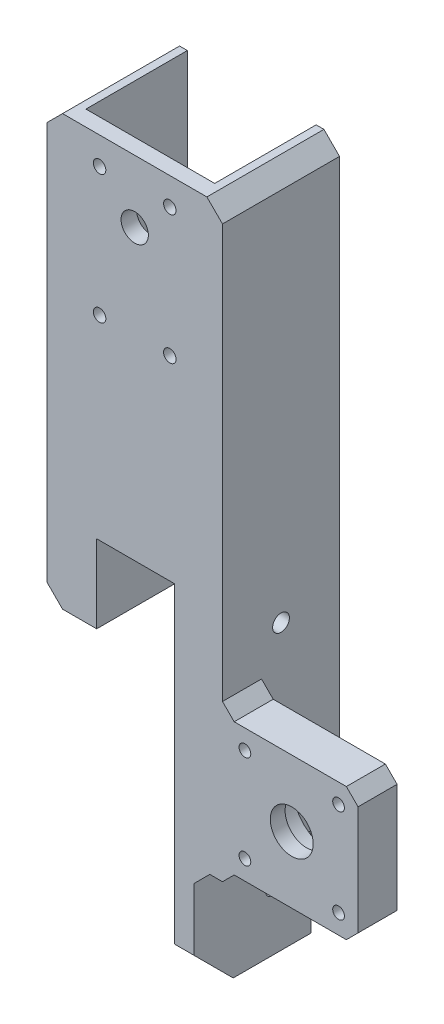
from build123d import *

# Parameters (mm, degrees)
SKETCH_1_W               = 33
SKETCH_1_H               = 47
SKETCH_1_R               = 1.6
SKETCH_1_R_2             = 3.5
EXTRUDE_1_DEPTH          = 4
EXTRUDE_2_DEPTH          = 30
EXTRUDE_START            = -4
SKETCH_4_W               = 33
SKETCH_4_H               = 38
EXTRUDE_3_DEPTH          = 4
SKETCH_6_W               = 50
SKETCH_6_H               = 40
SKETCH_6_R               = 5.5
SKETCH_6_R_2             = 1.5
EXTRUDE_4_DEPTH          = 30
SKETCH_7_W               = 37.75
SKETCH_7_H               = 40
CUT_EXTRUDE_1_DEPTH      = 20
SKETCH_8_R               = 9.75
CUT_EXTRUDE_2_DEPTH      = 6.2
SKETCH_10_R              = 2.15
CUT_EXTRUDE_4_DEPTH      = 136.486392306
SKETCH_11_W              = 30
SKETCH_11_H              = 30
SKETCH_11_R              = 1.7
EXTRUDE_5_DEPTH          = 5
CUT_EXTRUDE_5_DEPTH      = 20
CHAMFER_1_SIZE           = 4
CHAMFER_2_SIZE           = 3
CHAMFER_3_SIZE           = 10
CUT_EXTRUDE_6_DEPTH      = 164.487193688
CUT_EXTRUDE_6_DEPTH_BACK = 30
SKETCH_13_W              = 132.923896649
SKETCH_13_H              = 188.96680941
SKETCH_14_W              = 30
SKETCH_14_H              = 20
SKETCH_14_R              = 2.15
EXTRUDE_6_DEPTH          = 0.5


with BuildPart() as part:
    # 草图1 → 凸台-拉伸1 (new body)
    with BuildSketch(Plane.XY):
        with Locations((16.5, 23.5)):
            Rectangle(SKETCH_1_W, SKETCH_1_H)
        with Locations((7.5, 40)):
            Circle(SKETCH_1_R, mode=Mode.SUBTRACT)
        with Locations((25.5, 40)):
            Circle(SKETCH_1_R, mode=Mode.SUBTRACT)
        with Locations((7.5, 7)):
            Circle(SKETCH_1_R, mode=Mode.SUBTRACT)
        with Locations((25.5, 7)):
            Circle(SKETCH_1_R, mode=Mode.SUBTRACT)
        with Locations((16.5, 31)):
            Circle(SKETCH_1_R_2, mode=Mode.SUBTRACT)
    extrude(amount=EXTRUDE_1_DEPTH)

    # 草图3 → 凸台-拉伸2 (add)
    with BuildSketch(Plane(origin=(0, 0, 0), x_dir=(-1, 0, 0), z_dir=(0, 0, -1))):
        Polygon((0, -38), (-33, -38), (-33, 47), (-39, 47), (-39, -63), (-26.75, -63), (-26.75, -43), (-6.25, -43), (-6.25, -63), (6, -63), (6, 47), (0, 47), align=None)
    extrude(amount=-EXTRUDE_2_DEPTH)

    # 草图4 → 凸台-拉伸3 (add)
    with BuildSketch(Plane(origin=(0, 0, 0), x_dir=(-1, 0, 0), z_dir=(0, 0, -1)).offset(EXTRUDE_START)):
        with Locations((-16.5, -19)):
            Rectangle(SKETCH_4_W, SKETCH_4_H)
    extrude(amount=EXTRUDE_3_DEPTH)

    # 草图6 → 凸台-拉伸4 (add, through all)
    with BuildSketch(Plane(origin=(0, 0, 0), x_dir=(-1, 0, 0), z_dir=(0, 0, -1))):
        with Locations((-51.75, -83)):
            Rectangle(SKETCH_6_W, SKETCH_6_H)
        with Locations((-56.75, -83)):
            Circle(SKETCH_6_R, mode=Mode.SUBTRACT)
        with Locations((-68.75, -95)):
            Circle(SKETCH_6_R_2, mode=Mode.SUBTRACT)
        with Locations((-68.75, -71)):
            Circle(SKETCH_6_R_2, mode=Mode.SUBTRACT)
        with Locations((-44.75, -95)):
            Circle(SKETCH_6_R_2, mode=Mode.SUBTRACT)
        with Locations((-44.75, -71)):
            Circle(SKETCH_6_R_2, mode=Mode.SUBTRACT)
    extrude(amount=-EXTRUDE_4_DEPTH)

    # 草图7 → 切除-拉伸1 (cut)
    with BuildSketch(Plane.XY.offset(30)):
        with Locations((57.875, -83)):
            Rectangle(SKETCH_7_W, SKETCH_7_H)
    extrude(amount=-CUT_EXTRUDE_1_DEPTH, mode=Mode.SUBTRACT)

    # 草图8 → 切除-拉伸2 (cut)
    with BuildSketch(Plane.XY.offset(10)):
        with Locations((56.75, -83)):
            Circle(SKETCH_8_R)
    extrude(amount=-CUT_EXTRUDE_2_DEPTH, mode=Mode.SUBTRACT)

    # 草图10 → 切除-拉伸4 (cut, through all)
    with BuildSketch(Plane.ZY.offset(6)):
        with Locations(Location((15, -53, 0), (0, 0, 270))):
            Circle(SKETCH_10_R)
    extrude(amount=-CUT_EXTRUDE_4_DEPTH, mode=Mode.SUBTRACT)

    # 草图11 → 凸台-拉伸5 (add)
    with BuildSketch(Plane.ZY.offset(-26.75)):
        with Locations((15, -118)):
            Rectangle(SKETCH_11_W, SKETCH_11_H)
        with Locations(Location((20, -118, 0), (0, 0, 270))):
            Circle(SKETCH_11_R, mode=Mode.SUBTRACT)
    extrude(amount=-EXTRUDE_5_DEPTH)

    # 草图12 → 切除-拉伸5 (cut)
    with BuildSketch(Plane.XY.offset(10)):
        Polygon((39, -103), (76.75, -103), (76.75, -63), (39, -63), (39, -66), (73.75, -66), (73.75, -100), (39, -100), align=None)
    extrude(amount=-CUT_EXTRUDE_5_DEPTH, mode=Mode.SUBTRACT)

    # 倒角1
    chamfer_1_edges = [part.edges().sort_by_distance(p)[0] for p in [
        (31.75, -103, 15),
        (-6, 47, 15),
        (-6, -63, 15),
        (39, 47, 15),
    ]]
    chamfer(chamfer_1_edges, length=CHAMFER_1_SIZE)

    # 倒角2
    chamfer_2_edges = [part.edges().sort_by_distance(p)[0] for p in [
        (39, -100, 5),
        (39, -66, 5),
    ]]
    chamfer(chamfer_2_edges, length=CHAMFER_2_SIZE - 0.0001)  # a hair under: the kernel refuses the full size
    chamfer_2_2_edges = [part.edges().sort_by_distance(p)[0] for p in [
        (73.75, -100, 5),
        (73.75, -66, 5),
    ]]
    chamfer(chamfer_2_2_edges, length=CHAMFER_2_SIZE)

    # 倒角3
    chamfer_3_edges = [part.edges().sort_by_distance(p)[0] for p in [
        (29.25, -133, 0),
    ]]
    chamfer(chamfer_3_edges, length=CHAMFER_3_SIZE)


with BuildPart() as body_2:
    # 镜向1: mirrored copy
    add(part.part.mirror(Plane(origin=(0, 0, 0), x_dir=(1, 0, 0), z_dir=(0, 0, -1))))

    # 草图14 → 凸台-拉伸6 (add)
    with BuildSketch(Plane(origin=(6.25, 0, 0), x_dir=(0, 0, -1), z_dir=(1, 0, 0))):
        with Locations((15, -53)):
            Rectangle(SKETCH_14_W, SKETCH_14_H)
        with Locations(Location((15, -53, 0), (0, 0, 270))):
            Circle(SKETCH_14_R, mode=Mode.SUBTRACT)
    extrude(amount=EXTRUDE_6_DEPTH)


with BuildPart() as part_1:
    add(part.part)

    # 草图13 → 切除-拉伸6 (cut, two sides: drawn at the far end of the back side and taken through both)
    with BuildSketch(Plane.XY.offset(30).offset(-CUT_EXTRUDE_6_DEPTH_BACK)):
        with Locations((27.793899124, -40.302373562)):
            Rectangle(SKETCH_13_W, SKETCH_13_H)
    extrude(amount=CUT_EXTRUDE_6_DEPTH + CUT_EXTRUDE_6_DEPTH_BACK, mode=Mode.SUBTRACT)


solid = body_2.part
